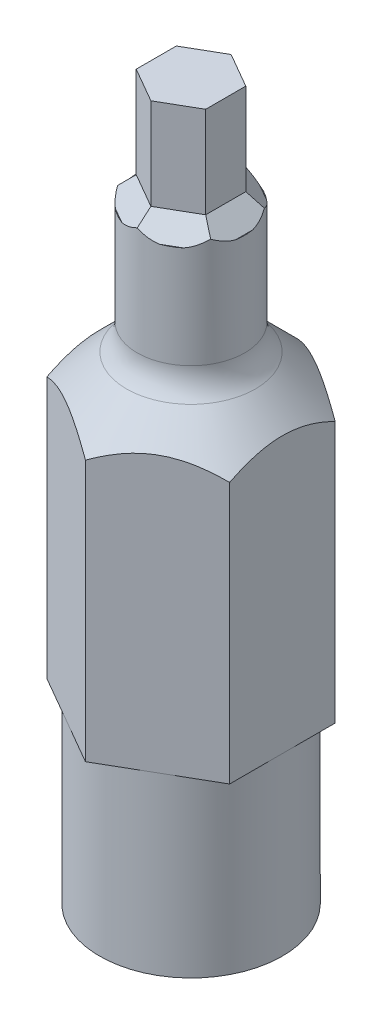
from build123d import *

# Parameters (mm, degrees)
BOSS_EXTRUDE1_DEPTH = 8.3312
SKETCH2_R           = 3.175
BOSS_EXTRUDE2_DEPTH = 6.096
SKETCH3_R           = 1.8669
BOSS_EXTRUDE3_DEPTH = 6.604
BOSS_EXTRUDE4_DEPTH = 3.81
CHAMFER1_SIZE       = 0.635
FILLET2_R           = 1.27


with BuildPart() as part:
    # Sketch1 → Boss-Extrude1 (new body)
    with BuildSketch(Plane(origin=(0, 0, 0), x_dir=(1, 0, 0), z_dir=(0, 1, 0))):
        Polygon((0, 3.666174209), (-3.175, 1.833087105), (-3.175, -1.833087105), (0, -3.666174209), (3.175, -1.833087105), (3.175, 1.833087105), align=None)
    extrude(amount=BOSS_EXTRUDE1_DEPTH)

    # Sketch2 → Boss-Extrude2 (add)
    with BuildSketch(Plane.XZ):
        with Locations(Location((0, 0, 0), (0, 0, 60))):
            Circle(SKETCH2_R)
    extrude(amount=BOSS_EXTRUDE2_DEPTH)

    # Sketch3 → Boss-Extrude3 (add)
    with BuildSketch(Plane(origin=(0, 8.3312, 0), x_dir=(1, 0, 0), z_dir=(0, 1, 0))):
        with Locations(Location((0, 0, 0), (0, 0, 90))):
            Circle(SKETCH3_R)
    extrude(amount=BOSS_EXTRUDE3_DEPTH)

    # Sketch4 → Boss-Extrude4 (add)
    with BuildSketch(Plane(origin=(0, 14.9352, 0), x_dir=(1, 0, 0), z_dir=(0, 1, 0))):
        Polygon((0, 1.3931462), (-1.2065, 0.6965731), (-1.2065, -0.6965731), (0, -1.3931462), (1.2065, -0.6965731), (1.2065, 0.6965731), align=None)
    extrude(amount=BOSS_EXTRUDE4_DEPTH)

    # Chamfer1
    # the kernel refuses this chamfer: 0.635 mm, written as the material it adds along each edge
    with BuildSketch(Plane(origin=(2.620735677, 14.9352, 0.119936249), x_dir=(0.4998109584556484, -0.027495876610587288, -0.8656979742248804), z_dir=(-0.8660254037844387, 0, -0.5000000000000001))) as chamfer1_piece_1_section:
        Polygon((CHAMFER1_SIZE * 0.999621916911, -CHAMFER1_SIZE * 0.0274958766106), (-CHAMFER1_SIZE * 0.0274958766106, -CHAMFER1_SIZE * 0.999621916911), (0, 0), align=None)
    chamfer1_piece_1 = extrude(amount=4.659183594, mode=Mode.PRIVATE)
    chamfer1_piece_1 = chamfer1_piece_1 & Plane(origin=(0, 15.158402941, 0), x_dir=(0, 0, -1), z_dir=(0, -1, 0)) * Cylinder(1.8669, 12, mode=Mode.PRIVATE)
    chamfer1_piece_1 = split(chamfer1_piece_1, bisect_by=Plane(origin=(0.439350473, 15.158402941, -1.646805313), z_dir=(0.49999999999999967, 0, 0.8660254037844388)), keep=Keep.TOP, mode=Mode.PRIVATE)
    chamfer1_piece_1 = split(chamfer1_piece_1, bisect_by=Plane(origin=(1.2065, 15.158402941, -1.203891328), z_dir=(-1, 0, 0)), keep=Keep.TOP, mode=Mode.PRIVATE)
    add(chamfer1_piece_1)
    with BuildSketch(Plane(origin=(1.414235677, 14.9352, -2.209655548), x_dir=(-0.49981095845564805, -0.02749587661058727, -0.8656979742248805), z_dir=(-0.8660254037844388, 0, 0.49999999999999967))) as chamfer1_piece_2_section:
        Polygon((CHAMFER1_SIZE * 0.999621916911, -CHAMFER1_SIZE * 0.0274958766106), (-CHAMFER1_SIZE * 0.0274958766106, -CHAMFER1_SIZE * 0.999621916911), (0, 0), align=None)
    chamfer1_piece_2 = extrude(amount=4.659183594, mode=Mode.PRIVATE)
    chamfer1_piece_2 = chamfer1_piece_2 & Plane(origin=(0, 15.158402941, 0), x_dir=(0, 0, -1), z_dir=(0, -1, 0)) * Cylinder(1.8669, 12, mode=Mode.PRIVATE)
    chamfer1_piece_2 = split(chamfer1_piece_2, bisect_by=Plane(origin=(-0.439350472, 15.158402941, -1.646805313), z_dir=(-0.5000000000000001, 0, 0.8660254037844387)), keep=Keep.TOP, mode=Mode.PRIVATE)
    chamfer1_piece_2 = split(chamfer1_piece_2, bisect_by=Plane(origin=(-1.2065, 15.158402941, -1.203891327), z_dir=(1, 0, 0)), keep=Keep.TOP, mode=Mode.PRIVATE)
    add(chamfer1_piece_2)
    with BuildSketch(Plane(origin=(-1.2065, 14.9352, -2.329591797), x_dir=(-0.9996219169112968, -0.027495876610587288, 0), z_dir=(0, 0, 1))) as chamfer1_piece_3_section:
        Polygon((CHAMFER1_SIZE * 0.999621916911, -CHAMFER1_SIZE * 0.0274958766106), (-CHAMFER1_SIZE * 0.0274958766106, -CHAMFER1_SIZE * 0.999621916911), (0, 0), align=None)
    chamfer1_piece_3 = extrude(amount=4.659183594, mode=Mode.PRIVATE)
    chamfer1_piece_3 = chamfer1_piece_3 & Plane(origin=(0, 15.158402941, 0), x_dir=(0, 0, -1), z_dir=(0, -1, 0)) * Cylinder(1.8669, 12, mode=Mode.PRIVATE)
    chamfer1_piece_3 = split(chamfer1_piece_3, bisect_by=Plane(origin=(-1.645850473, 15.158402941, -0.442913986), z_dir=(0.49999999999999967, 0, 0.8660254037844388)), keep=Keep.TOP, mode=Mode.PRIVATE)
    chamfer1_piece_3 = split(chamfer1_piece_3, bisect_by=Plane(origin=(-1.645850472, 15.158402941, 0.442913986), z_dir=(0.5000000000000001, 0, -0.8660254037844386)), keep=Keep.TOP, mode=Mode.PRIVATE)
    add(chamfer1_piece_3)
    with BuildSketch(Plane(origin=(-2.620735677, 14.9352, -0.119936249), x_dir=(-0.4998109584556485, -0.027495876610587288, 0.8656979742248802), z_dir=(0.8660254037844386, 0, 0.5000000000000001))) as chamfer1_piece_4_section:
        Polygon((CHAMFER1_SIZE * 0.999621916911, -CHAMFER1_SIZE * 0.0274958766106), (-CHAMFER1_SIZE * 0.0274958766106, -CHAMFER1_SIZE * 0.999621916911), (0, 0), align=None)
    chamfer1_piece_4 = extrude(amount=4.659183594, mode=Mode.PRIVATE)
    chamfer1_piece_4 = chamfer1_piece_4 & Plane(origin=(0, 15.158402941, 0), x_dir=(0, 0, -1), z_dir=(0, -1, 0)) * Cylinder(1.8669, 12, mode=Mode.PRIVATE)
    chamfer1_piece_4 = split(chamfer1_piece_4, bisect_by=Plane(origin=(-1.2065, 15.158402941, 1.203891327), z_dir=(1, 0, 0)), keep=Keep.TOP, mode=Mode.PRIVATE)
    chamfer1_piece_4 = split(chamfer1_piece_4, bisect_by=Plane(origin=(-0.439350472, 15.158402941, 1.646805313), z_dir=(-0.4999999999999998, 0, -0.8660254037844388)), keep=Keep.TOP, mode=Mode.PRIVATE)
    add(chamfer1_piece_4)
    with BuildSketch(Plane(origin=(-1.414235677, 14.9352, 2.209655548), x_dir=(0.49981095845564816, -0.02749587661058727, 0.8656979742248805), z_dir=(0.8660254037844388, 0, -0.4999999999999998))) as chamfer1_piece_5_section:
        Polygon((CHAMFER1_SIZE * 0.999621916911, -CHAMFER1_SIZE * 0.0274958766106), (-CHAMFER1_SIZE * 0.0274958766106, -CHAMFER1_SIZE * 0.999621916911), (0, 0), align=None)
    chamfer1_piece_5 = extrude(amount=4.659183594, mode=Mode.PRIVATE)
    chamfer1_piece_5 = chamfer1_piece_5 & Plane(origin=(0, 15.158402941, 0), x_dir=(0, 0, -1), z_dir=(0, -1, 0)) * Cylinder(1.8669, 12, mode=Mode.PRIVATE)
    chamfer1_piece_5 = split(chamfer1_piece_5, bisect_by=Plane(origin=(0.439350473, 15.158402941, 1.646805313), z_dir=(0.5000000000000001, 0, -0.8660254037844386)), keep=Keep.TOP, mode=Mode.PRIVATE)
    chamfer1_piece_5 = split(chamfer1_piece_5, bisect_by=Plane(origin=(1.2065, 15.158402941, 1.203891327), z_dir=(-1, 0, 0)), keep=Keep.TOP, mode=Mode.PRIVATE)
    add(chamfer1_piece_5)
    with BuildSketch(Plane(origin=(1.2065, 14.9352, 2.329591797), x_dir=(0.9996219169112968, -0.027495876610587288, 0), z_dir=(0, 0, -1))) as chamfer1_piece_6_section:
        Polygon((CHAMFER1_SIZE * 0.999621916911, -CHAMFER1_SIZE * 0.0274958766106), (-CHAMFER1_SIZE * 0.0274958766106, -CHAMFER1_SIZE * 0.999621916911), (0, 0), align=None)
    chamfer1_piece_6 = extrude(amount=4.659183594, mode=Mode.PRIVATE)
    chamfer1_piece_6 = chamfer1_piece_6 & Plane(origin=(0, 15.158402941, 0), x_dir=(0, 0, -1), z_dir=(0, -1, 0)) * Cylinder(1.8669, 12, mode=Mode.PRIVATE)
    chamfer1_piece_6 = split(chamfer1_piece_6, bisect_by=Plane(origin=(1.645850473, 15.158402941, 0.442913986), z_dir=(-0.4999999999999998, 0, -0.8660254037844388)), keep=Keep.TOP, mode=Mode.PRIVATE)
    chamfer1_piece_6 = split(chamfer1_piece_6, bisect_by=Plane(origin=(1.645850472, 15.158402941, -0.442913986), z_dir=(-0.5000000000000001, 0, 0.8660254037844387)), keep=Keep.TOP, mode=Mode.PRIVATE)
    add(chamfer1_piece_6)
    with BuildSketch(Plane(origin=(1.2065, 14.9352, 2.329591797), x_dir=(0.9996219169112968, -0.027495876610587288, 0), z_dir=(0, 0, -1))) as chamfer1_piece_7a_section:
        Polygon((CHAMFER1_SIZE * 0.999621916911, -CHAMFER1_SIZE * 0.0274958766106), (-CHAMFER1_SIZE * 0.0274958766106, -CHAMFER1_SIZE * 0.999621916911), (0, 0), align=None)
    chamfer1_piece_7a = extrude(amount=4.659183594, mode=Mode.PRIVATE)
    chamfer1_piece_7a = chamfer1_piece_7a & Plane(origin=(0, 15.161928265, 0), x_dir=(0, 0, -1), z_dir=(0, -1, 0)) * Cylinder(1.8669, 12, mode=Mode.PRIVATE)
    chamfer1_piece_7a = split(chamfer1_piece_7a, bisect_by=Plane(origin=(1.244933629, 15.161928265, -0.674383434), z_dir=(0.5000000000000001, 0, -0.8660254037844387)), keep=Keep.TOP, mode=Mode.PRIVATE)
    with BuildSketch(Plane(origin=(2.620735677, 14.9352, 0.119936249), x_dir=(0.4998109584556484, -0.027495876610587288, -0.8656979742248804), z_dir=(-0.8660254037844387, 0, -0.5000000000000001))) as chamfer1_piece_7b_section:
        Polygon((CHAMFER1_SIZE * 0.999621916911, -CHAMFER1_SIZE * 0.0274958766106), (-CHAMFER1_SIZE * 0.0274958766106, -CHAMFER1_SIZE * 0.999621916911), (0, 0), align=None)
    chamfer1_piece_7b = extrude(amount=4.659183594, mode=Mode.PRIVATE)
    chamfer1_piece_7b = chamfer1_piece_7b & Plane(origin=(0, 15.161928264, 0), x_dir=(0, 0, -1), z_dir=(0, -1, 0)) * Cylinder(1.8669, 12, mode=Mode.PRIVATE)
    chamfer1_piece_7b = split(chamfer1_piece_7b, bisect_by=Plane(origin=(1.2065, 15.161928264, -0.740952419), z_dir=(1, 0, 0)), keep=Keep.TOP, mode=Mode.PRIVATE)
    chamfer1_piece_7 = chamfer1_piece_7a & chamfer1_piece_7b
    add(chamfer1_piece_7)
    with BuildSketch(Plane(origin=(1.414235677, 14.9352, -2.209655548), x_dir=(-0.49981095845564805, -0.02749587661058727, -0.8656979742248805), z_dir=(-0.8660254037844388, 0, 0.49999999999999967))) as chamfer1_piece_8a_section:
        Polygon((CHAMFER1_SIZE * 0.999621916911, -CHAMFER1_SIZE * 0.0274958766106), (-CHAMFER1_SIZE * 0.0274958766106, -CHAMFER1_SIZE * 0.999621916911), (0, 0), align=None)
    chamfer1_piece_8a = extrude(amount=4.659183594, mode=Mode.PRIVATE)
    chamfer1_piece_8a = chamfer1_piece_8a & Plane(origin=(0, 15.161928254, 0), x_dir=(0, 0, -1), z_dir=(0, -1, 0)) * Cylinder(1.8669, 12, mode=Mode.PRIVATE)
    chamfer1_piece_8a = split(chamfer1_piece_8a, bisect_by=Plane(origin=(-0.038433634, 15.161928254, -1.415335868), z_dir=(0.5000000000000001, 0, -0.8660254037844387)), keep=Keep.TOP, mode=Mode.PRIVATE)
    with BuildSketch(Plane(origin=(2.620735677, 14.9352, 0.119936249), x_dir=(0.4998109584556484, -0.027495876610587288, -0.8656979742248804), z_dir=(-0.8660254037844387, 0, -0.5000000000000001))) as chamfer1_piece_8b_section:
        Polygon((CHAMFER1_SIZE * 0.999621916911, -CHAMFER1_SIZE * 0.0274958766106), (-CHAMFER1_SIZE * 0.0274958766106, -CHAMFER1_SIZE * 0.999621916911), (0, 0), align=None)
    chamfer1_piece_8b = extrude(amount=4.659183594, mode=Mode.PRIVATE)
    chamfer1_piece_8b = chamfer1_piece_8b & Plane(origin=(0, 15.16192826, 0), x_dir=(0, 0, -1), z_dir=(0, -1, 0)) * Cylinder(1.8669, 12, mode=Mode.PRIVATE)
    chamfer1_piece_8b = split(chamfer1_piece_8b, bisect_by=Plane(origin=(0.038433624, 15.16192826, -1.415335863), z_dir=(-0.49999999999999967, 0, -0.8660254037844388)), keep=Keep.TOP, mode=Mode.PRIVATE)
    chamfer1_piece_8 = chamfer1_piece_8a & chamfer1_piece_8b
    add(chamfer1_piece_8)
    with BuildSketch(Plane(origin=(1.414235677, 14.9352, -2.209655548), x_dir=(-0.49981095845564805, -0.02749587661058727, -0.8656979742248805), z_dir=(-0.8660254037844388, 0, 0.49999999999999967))) as chamfer1_piece_9a_section:
        Polygon((CHAMFER1_SIZE * 0.999621916911, -CHAMFER1_SIZE * 0.0274958766106), (-CHAMFER1_SIZE * 0.0274958766106, -CHAMFER1_SIZE * 0.999621916911), (0, 0), align=None)
    chamfer1_piece_9a = extrude(amount=4.659183594, mode=Mode.PRIVATE)
    chamfer1_piece_9a = chamfer1_piece_9a & Plane(origin=(0, 15.161928258, 0), x_dir=(0, 0, -1), z_dir=(0, -1, 0)) * Cylinder(1.8669, 12, mode=Mode.PRIVATE)
    chamfer1_piece_9a = split(chamfer1_piece_9a, bisect_by=Plane(origin=(-1.2065, 15.161928258, -0.740952435), z_dir=(-1, 0, 0)), keep=Keep.TOP, mode=Mode.PRIVATE)
    with BuildSketch(Plane(origin=(-1.2065, 14.9352, -2.329591797), x_dir=(-0.9996219169112968, -0.027495876610587288, 0), z_dir=(0, 0, 1))) as chamfer1_piece_9b_section:
        Polygon((CHAMFER1_SIZE * 0.999621916911, -CHAMFER1_SIZE * 0.0274958766106), (-CHAMFER1_SIZE * 0.0274958766106, -CHAMFER1_SIZE * 0.999621916911), (0, 0), align=None)
    chamfer1_piece_9b = extrude(amount=4.659183594, mode=Mode.PRIVATE)
    chamfer1_piece_9b = chamfer1_piece_9b & Plane(origin=(0, 15.161928252, 0), x_dir=(0, 0, -1), z_dir=(0, -1, 0)) * Cylinder(1.8669, 12, mode=Mode.PRIVATE)
    chamfer1_piece_9b = split(chamfer1_piece_9b, bisect_by=Plane(origin=(-1.244933623, 15.161928252, -0.674383437), z_dir=(-0.49999999999999967, 0, -0.8660254037844388)), keep=Keep.TOP, mode=Mode.PRIVATE)
    chamfer1_piece_9 = chamfer1_piece_9a & chamfer1_piece_9b
    add(chamfer1_piece_9)
    with BuildSketch(Plane(origin=(-1.2065, 14.9352, -2.329591797), x_dir=(-0.9996219169112968, -0.027495876610587288, 0), z_dir=(0, 0, 1))) as chamfer1_piece_10a_section:
        Polygon((CHAMFER1_SIZE * 0.999621916911, -CHAMFER1_SIZE * 0.0274958766106), (-CHAMFER1_SIZE * 0.0274958766106, -CHAMFER1_SIZE * 0.999621916911), (0, 0), align=None)
    chamfer1_piece_10a = extrude(amount=4.659183594, mode=Mode.PRIVATE)
    chamfer1_piece_10a = chamfer1_piece_10a & Plane(origin=(0, 15.161928265, 0), x_dir=(0, 0, -1), z_dir=(0, -1, 0)) * Cylinder(1.8669, 12, mode=Mode.PRIVATE)
    chamfer1_piece_10a = split(chamfer1_piece_10a, bisect_by=Plane(origin=(-1.244933629, 15.161928265, 0.674383434), z_dir=(-0.5000000000000001, 0, 0.8660254037844386)), keep=Keep.TOP, mode=Mode.PRIVATE)
    with BuildSketch(Plane(origin=(-2.620735677, 14.9352, -0.119936249), x_dir=(-0.4998109584556485, -0.027495876610587288, 0.8656979742248802), z_dir=(0.8660254037844386, 0, 0.5000000000000001))) as chamfer1_piece_10b_section:
        Polygon((CHAMFER1_SIZE * 0.999621916911, -CHAMFER1_SIZE * 0.0274958766106), (-CHAMFER1_SIZE * 0.0274958766106, -CHAMFER1_SIZE * 0.999621916911), (0, 0), align=None)
    chamfer1_piece_10b = extrude(amount=4.659183594, mode=Mode.PRIVATE)
    chamfer1_piece_10b = chamfer1_piece_10b & Plane(origin=(0, 15.161928252, 0), x_dir=(0, 0, -1), z_dir=(0, -1, 0)) * Cylinder(1.8669, 12, mode=Mode.PRIVATE)
    chamfer1_piece_10b = split(chamfer1_piece_10b, bisect_by=Plane(origin=(-1.2065, 15.161928252, 0.740952425), z_dir=(-1, 0, 0)), keep=Keep.TOP, mode=Mode.PRIVATE)
    chamfer1_piece_10 = chamfer1_piece_10a & chamfer1_piece_10b
    add(chamfer1_piece_10)
    with BuildSketch(Plane(origin=(-2.620735677, 14.9352, -0.119936249), x_dir=(-0.4998109584556485, -0.027495876610587288, 0.8656979742248802), z_dir=(0.8660254037844386, 0, 0.5000000000000001))) as chamfer1_piece_11a_section:
        Polygon((CHAMFER1_SIZE * 0.999621916911, -CHAMFER1_SIZE * 0.0274958766106), (-CHAMFER1_SIZE * 0.0274958766106, -CHAMFER1_SIZE * 0.999621916911), (0, 0), align=None)
    chamfer1_piece_11a = extrude(amount=4.659183594, mode=Mode.PRIVATE)
    chamfer1_piece_11a = chamfer1_piece_11a & Plane(origin=(0, 15.161928264, 0), x_dir=(0, 0, -1), z_dir=(0, -1, 0)) * Cylinder(1.8669, 12, mode=Mode.PRIVATE)
    chamfer1_piece_11a = split(chamfer1_piece_11a, bisect_by=Plane(origin=(-0.038433629, 15.161928264, 1.415335866), z_dir=(0.4999999999999998, 0, 0.8660254037844388)), keep=Keep.TOP, mode=Mode.PRIVATE)
    with BuildSketch(Plane(origin=(-1.414235677, 14.9352, 2.209655548), x_dir=(0.49981095845564816, -0.02749587661058727, 0.8656979742248805), z_dir=(0.8660254037844388, 0, -0.4999999999999998))) as chamfer1_piece_11b_section:
        Polygon((CHAMFER1_SIZE * 0.999621916911, -CHAMFER1_SIZE * 0.0274958766106), (-CHAMFER1_SIZE * 0.0274958766106, -CHAMFER1_SIZE * 0.999621916911), (0, 0), align=None)
    chamfer1_piece_11b = extrude(amount=4.659183594, mode=Mode.PRIVATE)
    chamfer1_piece_11b = chamfer1_piece_11b & Plane(origin=(0, 15.161928252, 0), x_dir=(0, 0, -1), z_dir=(0, -1, 0)) * Cylinder(1.8669, 12, mode=Mode.PRIVATE)
    chamfer1_piece_11b = split(chamfer1_piece_11b, bisect_by=Plane(origin=(0.038433623, 15.161928252, 1.415335862), z_dir=(-0.5000000000000001, 0, 0.8660254037844386)), keep=Keep.TOP, mode=Mode.PRIVATE)
    chamfer1_piece_11 = chamfer1_piece_11a & chamfer1_piece_11b
    add(chamfer1_piece_11)
    with BuildSketch(Plane(origin=(-1.414235677, 14.9352, 2.209655548), x_dir=(0.49981095845564816, -0.02749587661058727, 0.8656979742248805), z_dir=(0.8660254037844388, 0, -0.4999999999999998))) as chamfer1_piece_12a_section:
        Polygon((CHAMFER1_SIZE * 0.999621916911, -CHAMFER1_SIZE * 0.0274958766106), (-CHAMFER1_SIZE * 0.0274958766106, -CHAMFER1_SIZE * 0.999621916911), (0, 0), align=None)
    chamfer1_piece_12a = extrude(amount=4.659183594, mode=Mode.PRIVATE)
    chamfer1_piece_12a = chamfer1_piece_12a & Plane(origin=(0, 15.161928264, 0), x_dir=(0, 0, -1), z_dir=(0, -1, 0)) * Cylinder(1.8669, 12, mode=Mode.PRIVATE)
    chamfer1_piece_12a = split(chamfer1_piece_12a, bisect_by=Plane(origin=(1.2065, 15.161928264, 0.740952432), z_dir=(1, 0, 0)), keep=Keep.TOP, mode=Mode.PRIVATE)
    with BuildSketch(Plane(origin=(1.2065, 14.9352, 2.329591797), x_dir=(0.9996219169112968, -0.027495876610587288, 0), z_dir=(0, 0, -1))) as chamfer1_piece_12b_section:
        Polygon((CHAMFER1_SIZE * 0.999621916911, -CHAMFER1_SIZE * 0.0274958766106), (-CHAMFER1_SIZE * 0.0274958766106, -CHAMFER1_SIZE * 0.999621916911), (0, 0), align=None)
    chamfer1_piece_12b = extrude(amount=4.659183594, mode=Mode.PRIVATE)
    chamfer1_piece_12b = chamfer1_piece_12b & Plane(origin=(0, 15.161928252, 0), x_dir=(0, 0, -1), z_dir=(0, -1, 0)) * Cylinder(1.8669, 12, mode=Mode.PRIVATE)
    chamfer1_piece_12b = split(chamfer1_piece_12b, bisect_by=Plane(origin=(1.244933623, 15.161928252, 0.674383437), z_dir=(0.4999999999999998, 0, 0.8660254037844388)), keep=Keep.TOP, mode=Mode.PRIVATE)
    chamfer1_piece_12 = chamfer1_piece_12a & chamfer1_piece_12b
    add(chamfer1_piece_12)

    # Chamfer2
    # the kernel refuses this chamfer: 2.54 mm, written as the material it adds along each edge
    with BuildSketch(Plane(origin=(0, 8.3312, 0), x_dir=(0, 0, -1), z_dir=(1, 0, 0))) as chamfer2_piece_1_section:
        with BuildLine():
            Line((1.795057951, 2.611842049), (4.478742049, -0.071842049))
            Line((4.478742049, -0.071842049), (4.478742049, -0.122642049))
            ThreePointArc((4.478742049, -0.122642049), (3.172821024, -0.0508), (1.8669, -0.0508))
            Line((1.8669, -0.0508), (1.8161, 0))
            ThreePointArc((1.8161, 0), (1.8161, 1.305921024), (1.744257951, 2.611842049))
            Line((1.744257951, 2.611842049), (1.795057951, 2.611842049))
        make_face()
    chamfer2_piece_1 = revolve(axis=Axis((0, 8.3312, 0), (0, 1, 0)), mode=Mode.PRIVATE)
    chamfer2_piece_1 = split(chamfer2_piece_1, bisect_by=Plane(origin=(-2.759048579, 9.982443388, -2.07323677), z_dir=(0.4999999999999998, 0, 0.8660254037844388)), keep=Keep.TOP, mode=Mode.PRIVATE)
    chamfer2_piece_1 = split(chamfer2_piece_1, bisect_by=Plane(origin=(2.759048579, 9.982443388, -2.07323677), z_dir=(-0.5000000000000001, 0, 0.8660254037844386)), keep=Keep.TOP, mode=Mode.PRIVATE)
    chamfer2_piece_1 = split(chamfer2_piece_1, bisect_by=Plane(origin=(-3.175, 9.982443388, 2.705575549), z_dir=(1, 0, 0)), keep=Keep.TOP, mode=Mode.PRIVATE)
    chamfer2_piece_1 = split(chamfer2_piece_1, bisect_by=Plane(origin=(3.175, 9.982443388, 2.705575549), z_dir=(-1, 0, 0)), keep=Keep.TOP, mode=Mode.PRIVATE)
    chamfer2_piece_1 = split(chamfer2_piece_1, bisect_by=Plane(origin=(-0.415951421, 9.982443388, 3.426024544), z_dir=(0.5000000000000001, 0, -0.8660254037844386)), keep=Keep.TOP, mode=Mode.PRIVATE)
    chamfer2_piece_1 = split(chamfer2_piece_1, bisect_by=Plane(origin=(0.415951421, 9.982443388, 3.426024544), z_dir=(-0.5000000000000001, 0, -0.8660254037844386)), keep=Keep.TOP, mode=Mode.PRIVATE)
    add(chamfer2_piece_1)

    # Fillet2
    fillet2_edges = [part.edges().sort_by_distance(p)[0] for p in [
        (0, 10.8712, 1.8669),
    ]]
    fillet(fillet2_edges, radius=FILLET2_R)


solid = part.part
